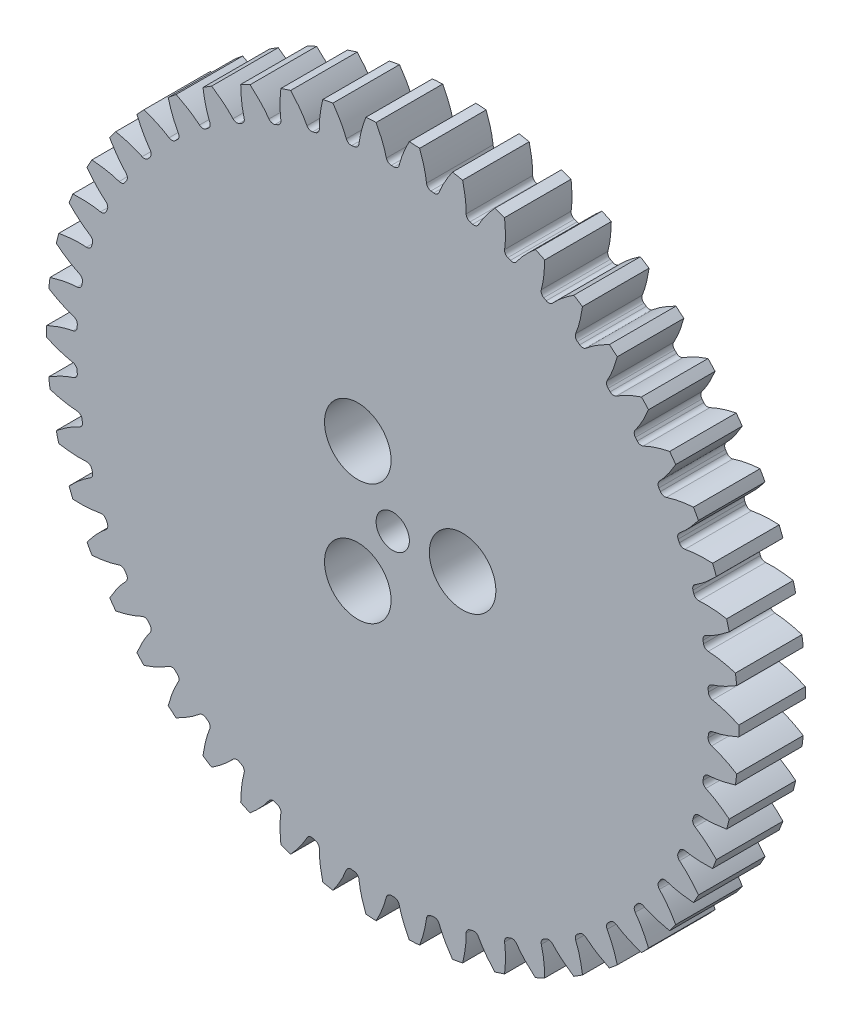
from build123d import *

# Parameters (mm, degrees)
SKETCH_1_R               = 52
LASHENA_DEPTH            = 10
CUT_EXTRUDEA_DEPTH       = 10
WWW_KYTOOL_CN_COUNT      = 50
CUT_EXTRUDE_2_REACH      = 76.174
SKETCH_3_R               = 2.5
CUT_EXTRUDE_3_REACH      = 76.174
SKETCH_4_R               = 5
PATTERN_CIRCULAR_1_COUNT = 3


with BuildPart() as part:
    # 草图1 → LaShenA (new body)
    with BuildSketch(Plane.XY):
        Circle(SKETCH_1_R)
    extrude(amount=LASHENA_DEPTH)

    # SketchA → Cut-ExtrudeA (cut)
    with BuildSketch(Plane.XY.offset(10)):
        with BuildLine():
            ThreePointArc((0.213590247, 47.499519779), (0, 47.5), (-0.213590247, 47.499519779))
            ThreePointArc((-0.213590247, 47.499519779), (-0.684257142, 47.660114105), (-0.954856281, 48.0773598))
            add(Edge.make_bspline(
                [(-0.954856281, 48.0773598), (-0.96541467, 48.120128917), (-0.985488821, 48.200845656), (-1.016380307, 48.321012667), (-1.048288969, 48.439462913), (-1.082846944, 48.562659977), (-1.120196777, 48.690549127), (-1.160430679, 48.823087673), (-1.203654363, 48.960227359), (-1.249968827, 49.101919388), (-1.299475501, 49.24811301), (-1.352274762, 49.39875593), (-1.408466318, 49.553794206), (-1.468149074, 49.713172294), (-1.53142114, 49.876833045), (-1.598379797, 50.044717723), (-1.669121482, 50.216766009), (-1.743741758, 50.392916022), (-1.822335298, 50.573104319), (-1.904995859, 50.75726592), (-1.99181626, 50.945334308), (-2.082888365, 51.137241451), (-2.178303053, 51.332917809), (-2.278150203, 51.53229235), (-2.38251867, 51.735292565), (-2.491496264, 51.941844476), (-2.605169733, 52.151872656), (-2.723624722, 52.365300242), (-2.889793337, 52.657357553), (-3.019269854, 52.87665295), (-3.108005271, 53.023443633)],
                knots=[0.100221083, 0.100221083, 0.100221083, 0.100221083, 0.122180925, 0.141688496, 0.162073335, 0.183335441, 0.205474814, 0.228491455, 0.252385363, 0.277156538, 0.302804981, 0.329330692, 0.35673367, 0.385013915, 0.414171428, 0.444206208, 0.475118255, 0.50690757, 0.539574153, 0.573118002, 0.60753912, 0.642837504, 0.679013156, 0.716066076, 0.753996263, 0.792803717, 0.832488439, 0.873050428, 0.914489685, 1, 1, 1, 1], degree=3))
            ThreePointArc((-3.108005271, 53.023443633), (0, 53.114454449), (3.108005271, 53.023443633))
            add(Edge.make_bspline(
                [(0.954856281, 48.0773598), (0.96541467, 48.120128917), (0.985488821, 48.200845656), (1.016380307, 48.321012667), (1.048288969, 48.439462913), (1.082846944, 48.562659977), (1.120196777, 48.690549127), (1.160430679, 48.823087673), (1.203654363, 48.960227359), (1.249968827, 49.101919388), (1.299475501, 49.24811301), (1.352274762, 49.39875593), (1.408466318, 49.553794206), (1.468149074, 49.713172294), (1.53142114, 49.876833045), (1.598379797, 50.044717723), (1.669121482, 50.216766009), (1.743741758, 50.392916022), (1.822335298, 50.573104319), (1.904995859, 50.75726592), (1.99181626, 50.945334308), (2.082888365, 51.137241451), (2.178303053, 51.332917809), (2.278150203, 51.53229235), (2.38251867, 51.735292565), (2.491496264, 51.941844476), (2.605169733, 52.151872656), (2.723624722, 52.365300242), (2.889793337, 52.657357553), (3.019269854, 52.87665295), (3.108005271, 53.023443633)],
                knots=[0.100221083, 0.100221083, 0.100221083, 0.100221083, 0.122180925, 0.141688496, 0.162073335, 0.183335441, 0.205474814, 0.228491455, 0.252385363, 0.277156538, 0.302804981, 0.329330692, 0.35673367, 0.385013915, 0.414171428, 0.444206208, 0.475118255, 0.50690757, 0.539574153, 0.573118002, 0.60753912, 0.642837504, 0.679013156, 0.716066076, 0.753996263, 0.792803717, 0.832488439, 0.873050428, 0.914489685, 1, 1, 1, 1], degree=3))
            ThreePointArc((0.954856281, 48.0773598), (0.684257142, 47.660114105), (0.213590247, 47.499519779))
        make_face()
    cut_extrudea = extrude(amount=-CUT_EXTRUDEA_DEPTH, mode=Mode.SUBTRACT)

    # www.KYTool.cn: Cut-ExtrudeA ×50 about axis
    www_kytool_cn_axis = Axis((0, 0, -88.99), (0, 0, 1))
    for i in range(1, WWW_KYTOOL_CN_COUNT):
        add(cut_extrudea.rotate(www_kytool_cn_axis, i * 360 / WWW_KYTOOL_CN_COUNT), mode=Mode.SUBTRACT)

    # 草图3 → 切除-拉伸2 (cut, up to next)
    with BuildSketch(Plane.XY.offset(10), mode=Mode.PRIVATE) as cut_extrude_2_sk1:
        Circle(SKETCH_3_R)
    cut_extrude_2_tool1 = extrude(cut_extrude_2_sk1.sketch, amount=-CUT_EXTRUDE_2_REACH, mode=Mode.PRIVATE) & part.part
    add(cut_extrude_2_tool1.solids().sort_by_distance((0, 0, 10))[0], mode=Mode.SUBTRACT)

    # 草图4 → 切除-拉伸3 (cut, up to next)
    with BuildSketch(Plane.XY.offset(10), mode=Mode.PRIVATE) as cut_extrude_3_sk1:
        with Locations((10.5, 0)):
            Circle(SKETCH_4_R)
    cut_extrude_3_tool1 = extrude(cut_extrude_3_sk1.sketch, amount=-CUT_EXTRUDE_3_REACH, mode=Mode.PRIVATE) & part.part
    cut_extrude_3 = cut_extrude_3_tool1.solids().sort_by_distance((10.5, 0, 10))[0]
    add(cut_extrude_3, mode=Mode.SUBTRACT)

    # 阵列(圆周)1: 切除-拉伸3 ×3 about axis
    pattern_circular_1_axis = Axis((0, 0, -0.001), (0, 0, 1))
    for i in range(1, PATTERN_CIRCULAR_1_COUNT):
        add(cut_extrude_3.rotate(pattern_circular_1_axis, i * 360 / PATTERN_CIRCULAR_1_COUNT), mode=Mode.SUBTRACT)


solid = part.part
